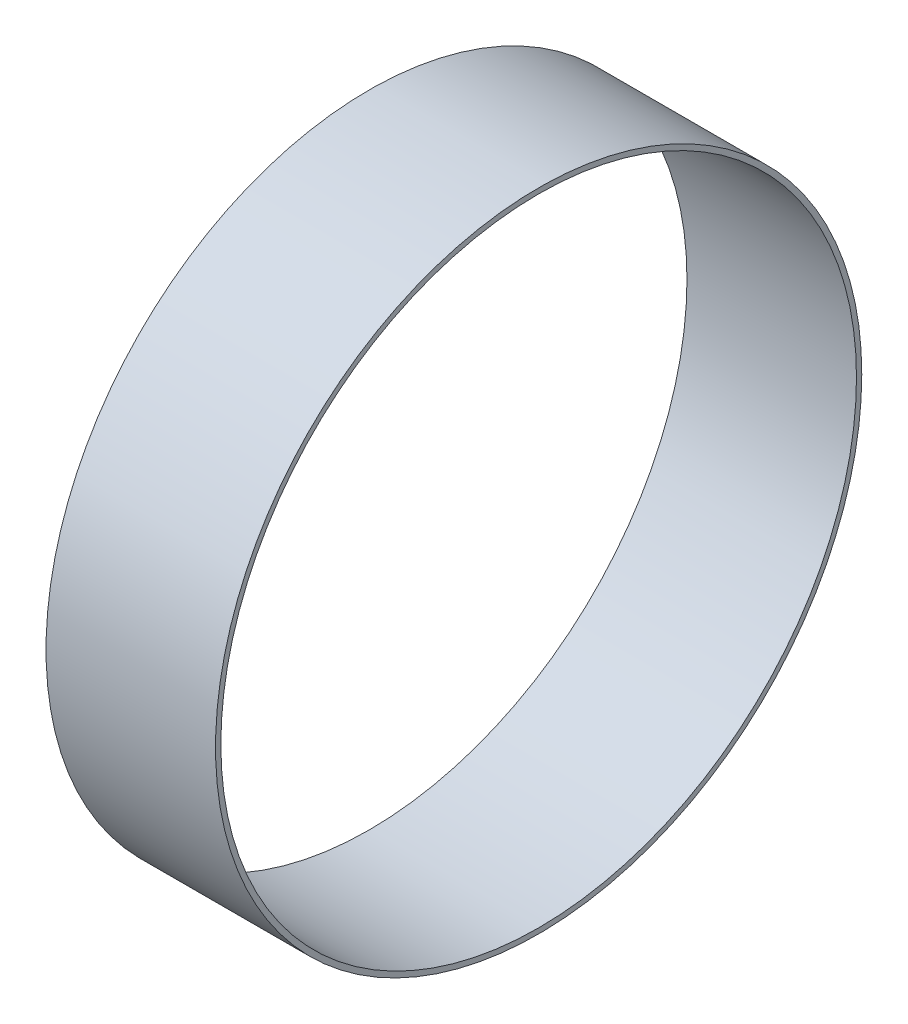
from build123d import *

# Parameters (mm, degrees)
SKETCH1_R           = 193.675
SKETCH1_R_2         = 190.5
BOSS_EXTRUDE1_DEPTH = 101.6


with BuildPart() as part:
    # Sketch1 → Boss-Extrude1 (new body)
    with BuildSketch(Plane(origin=(0, 0, 0), x_dir=(0, 0, -1), z_dir=(1, 0, 0))):
        Circle(SKETCH1_R)
        Circle(SKETCH1_R_2, mode=Mode.SUBTRACT)
    extrude(amount=BOSS_EXTRUDE1_DEPTH)


solid = part.part
